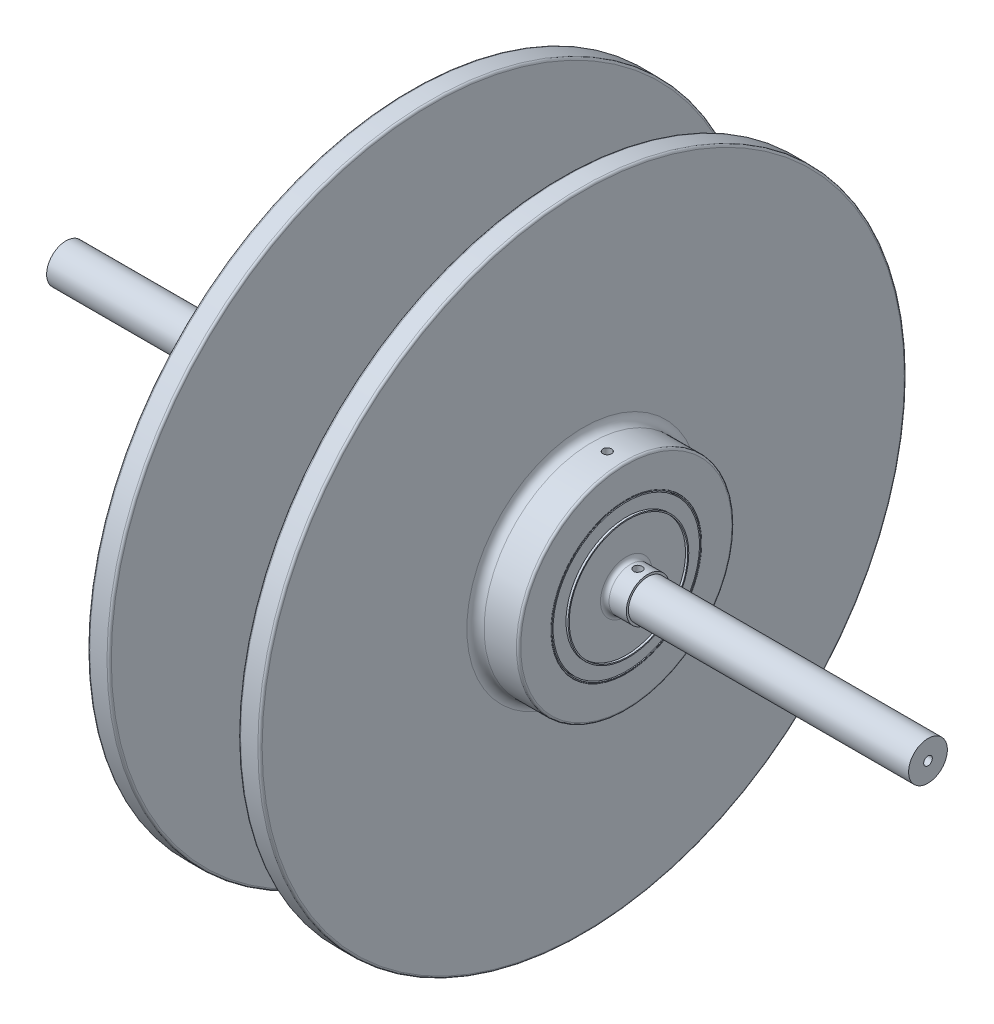
from build123d import *

# Parameters (mm, degrees)
SKETCH2_R           = 75
BOSS_EXTRUDE1_DEPTH = 5
SKETCH3_R           = 15
BOSS_EXTRUDE2_DEPTH = 15
SKETCH4_R           = 25
BOSS_EXTRUDE3_DEPTH = 10
SKETCH5_R           = 17.5
SKETCH5_R_2         = 17.45
CUT_EXTRUDE1_DEPTH  = 5
SKETCH8_R           = 17.25
SKETCH8_R_2         = 17
CUT_EXTRUDE2_DEPTH  = 5
SKETCH9_R           = 14
SKETCH9_R_2         = 13.75
BOSS_EXTRUDE5_DEPTH = 0.5
SKETCH11_R          = 5
SKETCH11_R_2        = 4.5
BOSS_EXTRUDE7_DEPTH = 5
SKETCH12_R          = 4.5
BOSS_EXTRUDE8_DEPTH = 70
FILLET2_R           = 2
FILLET3_R           = 1
FILLET5_R           = 15
FILLET6_R           = 1
FILLET7_R           = 0.5
FILLET8_R           = 0.5
FILLET9_R           = 0.5
FILLET10_R          = 0.5
FILLET11_R          = 0.5
SKETCH15_R          = 1
CUT_EXTRUDE4_DEPTH  = 10
SKETCH16_R          = 1
CUT_EXTRUDE6_DEPTH  = 40
FILLET12_R          = 0.5
FILLET13_R          = 1
SKETCH17_R          = 1
CUT_EXTRUDE7_DEPTH  = 124
SKETCH19_R          = 1
CUT_EXTRUDE8_DEPTH  = 124


with BuildPart() as part:
    # Sketch2 → Boss-Extrude1 (new body)
    with BuildSketch(Plane(origin=(15, 0, 0), x_dir=(0, 0, -1), z_dir=(1, 0, 0))):
        Circle(SKETCH2_R)
    boss_extrude1 = extrude(amount=BOSS_EXTRUDE1_DEPTH)

    # Sketch3 → Boss-Extrude2 (add)
    with BuildSketch(Plane.ZY.offset(-15)):
        with Locations((-0.004812297, 0.006333949)):
            Circle(SKETCH3_R)
    boss_extrude2 = extrude(amount=BOSS_EXTRUDE2_DEPTH)

    # Sketch4 → Boss-Extrude3 (add)
    with BuildSketch(Plane(origin=(20, 0, 0), x_dir=(0, 0, -1), z_dir=(1, 0, 0))):
        Circle(SKETCH4_R)
    boss_extrude3 = extrude(amount=BOSS_EXTRUDE3_DEPTH)

    # Sketch5 → Cut-Extrude1 (cut)
    with BuildSketch(Plane(origin=(30, 0, 0), x_dir=(0, 0, -1), z_dir=(1, 0, 0))):
        Circle(SKETCH5_R)
        with Locations((-0.001736247, 0.008937991)):
            Circle(SKETCH5_R_2, mode=Mode.SUBTRACT)
    extrude(amount=-CUT_EXTRUDE1_DEPTH, mode=Mode.SUBTRACT)

    # Sketch8 → Cut-Extrude2 (cut)
    with BuildSketch(Plane(origin=(30, 0, 0), x_dir=(0, 0, -1), z_dir=(1, 0, 0))):
        Circle(SKETCH8_R)
        with Locations((0.000516052, 0.004699606)):
            Circle(SKETCH8_R_2, mode=Mode.SUBTRACT)
    cut_extrude2 = extrude(amount=-CUT_EXTRUDE2_DEPTH, mode=Mode.SUBTRACT)

    # Sketch9 → Boss-Extrude5 (add)
    with BuildSketch(Plane(origin=(30, 0, 0), x_dir=(0, 0, -1), z_dir=(1, 0, 0))):
        Circle(SKETCH9_R)
        Circle(SKETCH9_R_2, mode=Mode.SUBTRACT)
    boss_extrude5 = extrude(amount=BOSS_EXTRUDE5_DEPTH)

    # Sketch11 → Boss-Extrude7 (add)
    with BuildSketch(Plane(origin=(30, 0, 0), x_dir=(0, 0, -1), z_dir=(1, 0, 0))):
        Circle(SKETCH11_R)
        with Locations((-4.7503e-05, 0.000937112)):
            Circle(SKETCH11_R_2, mode=Mode.SUBTRACT)
    boss_extrude7 = extrude(amount=BOSS_EXTRUDE7_DEPTH)

    # Sketch12 → Boss-Extrude8 (add)
    with BuildSketch(Plane(origin=(30, 0, 0), x_dir=(0, 0, -1), z_dir=(1, 0, 0))):
        with Locations(Location((-0.005388207, 0, 0), (0, 0, 99.917629206))):
            Circle(SKETCH12_R)
    boss_extrude8 = extrude(amount=BOSS_EXTRUDE8_DEPTH)

    # Fillet2
    fillet2_edges = [part.edges().sort_by_distance(p)[0] for p in [
        (20, 0, 25),
    ]]
    fillet(fillet2_edges, radius=FILLET2_R)

    # Fillet3
    fillet3_edges = [part.edges().sort_by_distance(p)[0] for p in [
        (30, 0, 5),
    ]]
    fillet(fillet3_edges, radius=FILLET3_R)

    # Mirror10: Boss-Extrude2 across plane
    add(boss_extrude2.mirror(Plane(origin=(0, 0, 0), x_dir=(0, 0, 1), z_dir=(1, 0, 0))))

    # Mirror11: Boss-Extrude1 across plane
    add(boss_extrude1.mirror(Plane(origin=(0, 0, 0), x_dir=(0, 0, 1), z_dir=(1, 0, 0))))

    # Mirror12: Boss-Extrude3 across plane
    add(boss_extrude3.mirror(Plane(origin=(0, 0, 0), x_dir=(0, 0, 1), z_dir=(1, 0, 0))))

    # Mirror15: Cut-Extrude2 across plane
    add(cut_extrude2.mirror(Plane(origin=(0, 0, 0), x_dir=(0, 0, 1), z_dir=(1, 0, 0))), mode=Mode.SUBTRACT)

    # Mirror17: Boss-Extrude5 across plane
    add(boss_extrude5.mirror(Plane(origin=(0, 0, 0), x_dir=(0, 0, 1), z_dir=(1, 0, 0))))

    # Mirror18: Boss-Extrude7 across plane
    add(boss_extrude7.mirror(Plane(origin=(0, 0, 0), x_dir=(0, 0, 1), z_dir=(1, 0, 0))))

    # Mirror19: Boss-Extrude8 across plane
    add(boss_extrude8.mirror(Plane(origin=(0, 0, 0), x_dir=(0, 0, 1), z_dir=(1, 0, 0))))

    # Fillet4: read off the stored shape, not the designer's step
    # Fillet4 outline → Fillet4 (revolve)
    with BuildSketch(Plane(origin=(0, 0.006333949, -0.004812297), x_dir=(0, 1, 0), z_dir=(0, 0, -1))):
        with BuildLine():
            Line((15, -15), (30, -15))
            ThreePointArc((30, -15), (19.393398282, -10.606601718), (15, 0))
            Line((15, 0), (15, -15))
        make_face()
    revolve(axis=Axis((0, 0.006333949, -0.004812297), (1, 0, 0)))

    # Fillet5
    fillet5_edges = [part.edges().sort_by_distance(p)[0] for p in [
        (15, 0.006333949, -15.004812297),
    ]]
    fillet(fillet5_edges, radius=FILLET5_R - 0.0001)  # a hair under: the kernel refuses the full size

    # Fillet6
    fillet6_edges = [part.edges().sort_by_distance(p)[0] for p in [
        (-30, 0, 5),
    ]]
    fillet(fillet6_edges, radius=FILLET6_R)

    # Fillet7
    fillet7_edges = [part.edges().sort_by_distance(p)[0] for p in [
        (30, 0, 25),
    ]]
    fillet(fillet7_edges, radius=FILLET7_R)

    # Fillet8
    fillet8_edges = [part.edges().sort_by_distance(p)[0] for p in [
        (20, 0, 75),
    ]]
    fillet(fillet8_edges, radius=FILLET8_R)

    # Fillet9
    fillet9_edges = [part.edges().sort_by_distance(p)[0] for p in [
        (15, 0, 75),
    ]]
    fillet(fillet9_edges, radius=FILLET9_R)

    # Fillet10
    fillet10_edges = [part.edges().sort_by_distance(p)[0] for p in [
        (-15, 0, 75),
    ]]
    fillet(fillet10_edges, radius=FILLET10_R)

    # Fillet11
    fillet11_edges = [part.edges().sort_by_distance(p)[0] for p in [
        (-20, 0, 75),
    ]]
    fillet(fillet11_edges, radius=FILLET11_R)

    # Sketch15 → Cut-Extrude4 (cut, symmetric)
    with BuildSketch(Plane(origin=(0, 0, 0), x_dir=(1, 0, 0), z_dir=(0, 1, 0))):
        with Locations(Location((32.725349861, 0, 0), (0, 0, 90))):
            Circle(SKETCH15_R)
    cut_extrude4 = extrude(amount=CUT_EXTRUDE4_DEPTH, both=True, mode=Mode.SUBTRACT)

    # Mirror20: Cut-Extrude4 across plane
    add(cut_extrude4.mirror(Plane(origin=(0, 0, 0), x_dir=(0, 0, 1), z_dir=(1, 0, 0))), mode=Mode.SUBTRACT)

    # Sketch16 → Cut-Extrude6 (cut, symmetric)
    with BuildSketch(Plane(origin=(0, 0, 0), x_dir=(1, 0, 0), z_dir=(0, 1, 0))):
        with Locations(Location((25.586456916, 0, 0), (0, 0, 90))):
            Circle(SKETCH16_R)
    cut_extrude6 = extrude(amount=CUT_EXTRUDE6_DEPTH, both=True, mode=Mode.SUBTRACT)

    # Fillet12
    fillet12_edges = [part.edges().sort_by_distance(p)[0] for p in [
        (-30, 0, 25),
    ]]
    fillet(fillet12_edges, radius=FILLET12_R)

    # Fillet13
    fillet13_edges = [part.edges().sort_by_distance(p)[0] for p in [
        (-20, 0, 25),
    ]]
    fillet(fillet13_edges, radius=FILLET13_R)

    # Sketch17 → Cut-Extrude7 (cut)
    with BuildSketch(Plane(origin=(100, 0, 0), x_dir=(0, 0, -1), z_dir=(1, 0, 0))):
        Circle(SKETCH17_R)
    extrude(amount=-CUT_EXTRUDE7_DEPTH, mode=Mode.SUBTRACT)

    # Sketch19 → Cut-Extrude8 (cut)
    with BuildSketch(Plane.XY):
        with Locations((-25.953120533, 0)):
            Circle(SKETCH19_R)
    extrude(amount=-CUT_EXTRUDE8_DEPTH, mode=Mode.SUBTRACT)

    # Mirror23: Cut-Extrude6 across plane
    add(cut_extrude6.mirror(Plane(origin=(0, 0, 0), x_dir=(0, 0, 1), z_dir=(1, 0, 0))), mode=Mode.SUBTRACT)


solid = part.part
